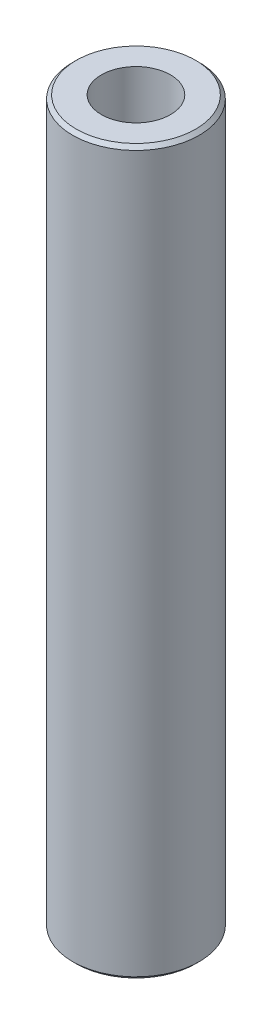
from build123d import *

# Parameters (mm, degrees)
SKETCH1_R           = 52.5
BOSS_EXTRUDE1_DEPTH = 600
SKETCH2_R           = 28.666934008
CUT_EXTRUDE1_DEPTH  = 605.576297914
CHAMFER1_SIZE       = 2.952577277


with BuildPart() as part:
    # Sketch1 → Boss-Extrude1 (new body)
    with BuildSketch(Plane(origin=(0, 0, 0), x_dir=(1, 0, 0), z_dir=(0, 1, 0))):
        Circle(SKETCH1_R)
    extrude(amount=BOSS_EXTRUDE1_DEPTH)

    # Sketch2 → Cut-Extrude1 (cut, through all)
    with BuildSketch(Plane(origin=(0, 0, 0), x_dir=(1, 0, 0), z_dir=(0, 1, 0))):
        Circle(SKETCH2_R)
    extrude(amount=CUT_EXTRUDE1_DEPTH, mode=Mode.SUBTRACT)

    # Chamfer1
    chamfer1_edges = [part.edges().sort_by_distance(p)[0] for p in [
        (-52.5, 600, 0),
        (-52.5, 0, 0),
    ]]
    chamfer(chamfer1_edges, length=CHAMFER1_SIZE)


solid = part.part
